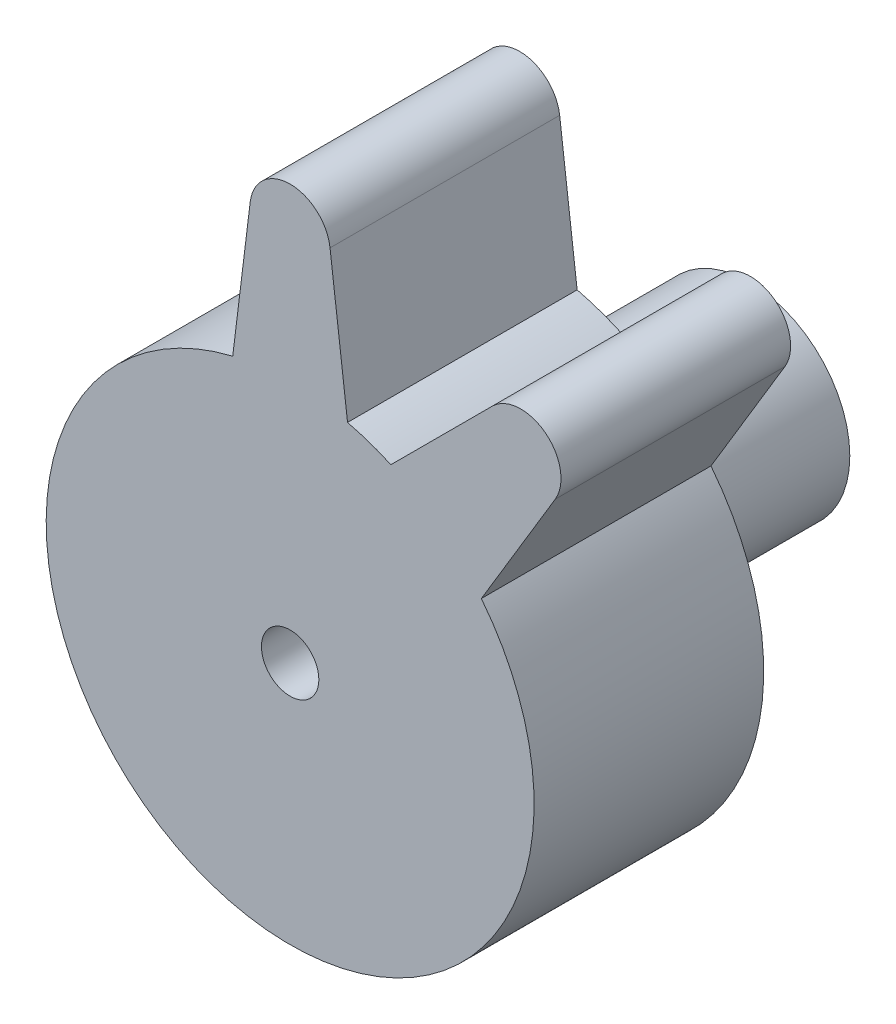
from build123d import *

# Parameters (mm, degrees)
SKETCH1_R           = 1
BOSS_EXTRUDE1_DEPTH = 8
BOSS_EXTRUDE3_DEPTH = 8
SKETCH6_R           = 1
CUT_EXTRUDE1_DEPTH  = 2


with BuildPart() as part:
    # Sketch1 → Boss-Extrude1 (new body)
    with BuildSketch(Plane.XY):
        with BuildLine():
            Line((-1.390653283, 13.224086579), (-2, 8.261355821))
            ThreePointArc((-2, 8.261355821), (-2.767329313, -8.036907893), (6.66222002, 5.278714276))
            Line((6.66222002, 5.278714276), (9.237410395, 9.564550779))
            ThreePointArc((9.237410395, 9.564550779), (8.899037344, 11.390248383), (7.045710912, 11.276894083))
            Line((7.045710912, 11.276894083), (3.510177006, 7.741360177))
            ThreePointArc((3.510177006, 7.741360177), (2.767329313, 8.036907893), (2, 8.261355821))
            Line((2, 8.261355821), (1.390653283, 13.224086579))
            ThreePointArc((1.390653283, 13.224086579), (0, 14.454432673), (-1.390653283, 13.224086579))
        make_face()
        Circle(SKETCH1_R, mode=Mode.SUBTRACT)
    extrude(amount=BOSS_EXTRUDE1_DEPTH)

    # Sketch5 → Boss-Extrude3 (add)
    with BuildSketch(Plane(origin=(0, 0, 0), x_dir=(-1, 0, 0), z_dir=(0, 0, -1))):
        with BuildLine():
            ThreePointArc((3.16227766, 1.5), (-3.5, 0), (3.16227766, -1.5))
            Line((3.16227766, -1.5), (3.16227766, 1.5))
        make_face()
        with BuildLine():
            Line((1.322875656, 1.5), (1.322875656, -1.5))
            ThreePointArc((1.322875656, -1.5), (-2, 0), (1.322875656, 1.5))
        make_face(mode=Mode.SUBTRACT)
    extrude(amount=BOSS_EXTRUDE3_DEPTH)

    # Sketch6 → Cut-Extrude1 (cut)
    with BuildSketch(Plane.ZY.offset(3.16227766)):
        with Locations((-5, 0)):
            Circle(SKETCH6_R)
    extrude(amount=-CUT_EXTRUDE1_DEPTH, mode=Mode.SUBTRACT)


solid = part.part
